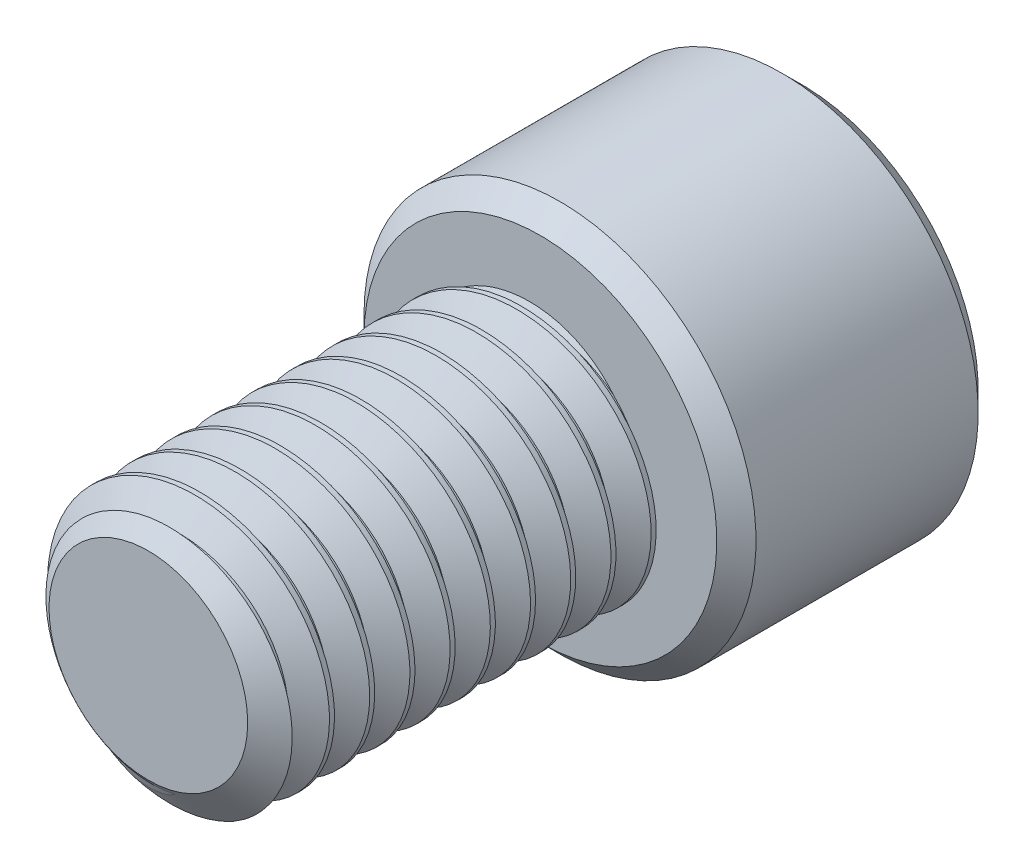
from build123d import *

# Parameters (mm, degrees)
SKETCH1_R          = 6.35
EXTRUDE1_DEPTH     = 19.05
CUT_SWEEP1_PITCH   = 1.953846154
SKETCH6_R          = 9.525
EXTRUDE2_DEPTH     = 12.7
CUT_EXTRUDE1_DEPTH = 7.14375
CHAMFER1_SIZE      = 0.9525


with BuildPart() as part:
    # Sketch1 → Extrude1 (new body)
    with BuildSketch(Plane.XY):
        Circle(SKETCH1_R)
    extrude(amount=-EXTRUDE1_DEPTH)

    # Cut-Sweep1: the profile of Sketch3 profile screwed along a right-hand helix of 10.75 turns, 6 arcs to a turn; built about Z, then put on its axis
    cut_sweep1_z = Axis((0, 0, 0), (0, 0, 1))
    cut_sweep1_corners = [(6.3503, 0, -1.70978859), (5.080939697, 0, -0.976923077), (5.080939697, 0, -0.732692308), (6.3503, 0, 0.000173205)]
    with BuildLine(mode=Mode.PRIVATE) as cut_sweep1_profile:
        Line(cut_sweep1_corners[0], cut_sweep1_corners[1])
        Line(cut_sweep1_corners[1], cut_sweep1_corners[2])
        Line(cut_sweep1_corners[2], cut_sweep1_corners[3])
        Line(cut_sweep1_corners[3], cut_sweep1_corners[0])
    cut_sweep1_cap = Face(cut_sweep1_profile.wire())
    cut_sweep1_turn_angles = [0, 30, 60, 90, 120, 150, 180, 210, 240, 270, 300, 330, 360]
    cut_sweep1_turn_weights = [1, 0.8660254037844387, 1, 0.8660254037844387, 1, 0.8660254037844387, 1, 0.8660254037844387, 1, 0.8660254037844387, 1, 0.8660254037844387, 1]
    cut_sweep1_turn_rails = [Edge.make_bspline([Vector(p[0], p[1], 0).rotate(cut_sweep1_z, cut_sweep1_turn_angles[k]) / cut_sweep1_turn_weights[k] + Vector(0, 0, p[2] + CUT_SWEEP1_PITCH * cut_sweep1_turn_angles[k] / 360) for k in range(13)], [0, 0, 0, 1, 1, 2, 2, 3, 3, 4, 4, 5, 5, 6, 6, 6], 2, cut_sweep1_turn_weights) for p in cut_sweep1_corners]
    cut_sweep1_turn_sides = [Face.make_surface_from_curves(cut_sweep1_turn_rails[p[0]], cut_sweep1_turn_rails[p[1]]) for p in [(0, 1), (1, 2), (2, 3), (3, 0)]]
    cut_sweep1_last_angles = [3600, 3630, 3660, 3690, 3720, 3750, 3780, 3810, 3840, 3855, 3870]
    cut_sweep1_last_weights = [1, 0.8660254037844387, 1, 0.8660254037844387, 1, 0.8660254037844387, 1, 0.8660254037844387, 1, 0.9659258262890734, 1]
    cut_sweep1_last_rails = [Edge.make_bspline([Vector(p[0], p[1], 0).rotate(cut_sweep1_z, cut_sweep1_last_angles[k]) / cut_sweep1_last_weights[k] + Vector(0, 0, p[2] + CUT_SWEEP1_PITCH * cut_sweep1_last_angles[k] / 360) for k in range(11)], [0, 0, 0, 1, 1, 2, 2, 3, 3, 4, 4, 5, 5, 5], 2, cut_sweep1_last_weights) for p in cut_sweep1_corners]
    cut_sweep1_last_sides = [Face.make_surface_from_curves(cut_sweep1_last_rails[p[0]], cut_sweep1_last_rails[p[1]]) for p in [(0, 1), (1, 2), (2, 3), (3, 0)]]
    cut_sweep1 = Plane(origin=(0, 0, 0), x_dir=(0, 1, 0), z_dir=(0, 0, -1)) * Solid(Shell([*[p.moved(Location((0, 0, CUT_SWEEP1_PITCH * i))) for i in range(10) for p in cut_sweep1_turn_sides], *cut_sweep1_last_sides, cut_sweep1_cap, cut_sweep1_cap.rotate(cut_sweep1_z, 3870).moved(Location((0, 0, CUT_SWEEP1_PITCH * 3870 / 360)))]))
    add(cut_sweep1, mode=Mode.SUBTRACT)

    # Sketch4 → Cut-Revolve1 (revolve, cut)
    with BuildSketch(Plane(origin=(0, 0, 0), x_dir=(0, 0, -1), z_dir=(1, 0, 0)), mode=Mode.PRIVATE) as cut_revolve1_sk:
        Polygon((1.066458305, 6.35), (0, 4.826939697), (0, 6.35), align=None)
    revolve(cut_revolve1_sk.sketch.rotate(Axis((0, 0, 0), (0, 0, -1)), 212.645821127), axis=Axis((0, 0, 0), (0, 0, -1)), mode=Mode.SUBTRACT)

    # Sketch6 → Extrude2 (add)
    with BuildSketch(Plane(origin=(0, 0, -19.05), x_dir=(-1, 0, 0), z_dir=(0, 0, -1))):
        Circle(SKETCH6_R)
    extrude(amount=EXTRUDE2_DEPTH)

    # Sketch7 → Cut-Extrude1 (cut)
    with BuildSketch(Plane(origin=(0, 0, -31.75), x_dir=(-1, 0, 0), z_dir=(0, 0, -1))):
        Polygon((0, 5.499261314), (-4.7625, 2.749630657), (-4.7625, -2.749630657), (0, -5.499261314), (4.7625, -2.749630657), (4.7625, 2.749630657), align=None)
    extrude(amount=-CUT_EXTRUDE1_DEPTH, mode=Mode.SUBTRACT)

    # Cut-Extrude2 cone 1 section (through the dimple's axis) → Cut-Extrude2 (revolve, cut)
    with BuildSketch(Plane(origin=(0, 0, -31.75), x_dir=(0, 1, 0), z_dir=(1, 0, 0))):
        Polygon((0, 0), (5.499261314, 0), (0, 5.499261314), align=None)
    revolve(axis=Axis((0, 0, -31.75), (0, 0, 1)), mode=Mode.SUBTRACT)

    # Chamfer1
    chamfer1_edges = [part.edges().sort_by_distance(p)[0] for p in [
        (9.525, 0, -19.05),
        (9.525, 0, -31.75),
    ]]
    chamfer(chamfer1_edges, length=CHAMFER1_SIZE)


solid = part.part
